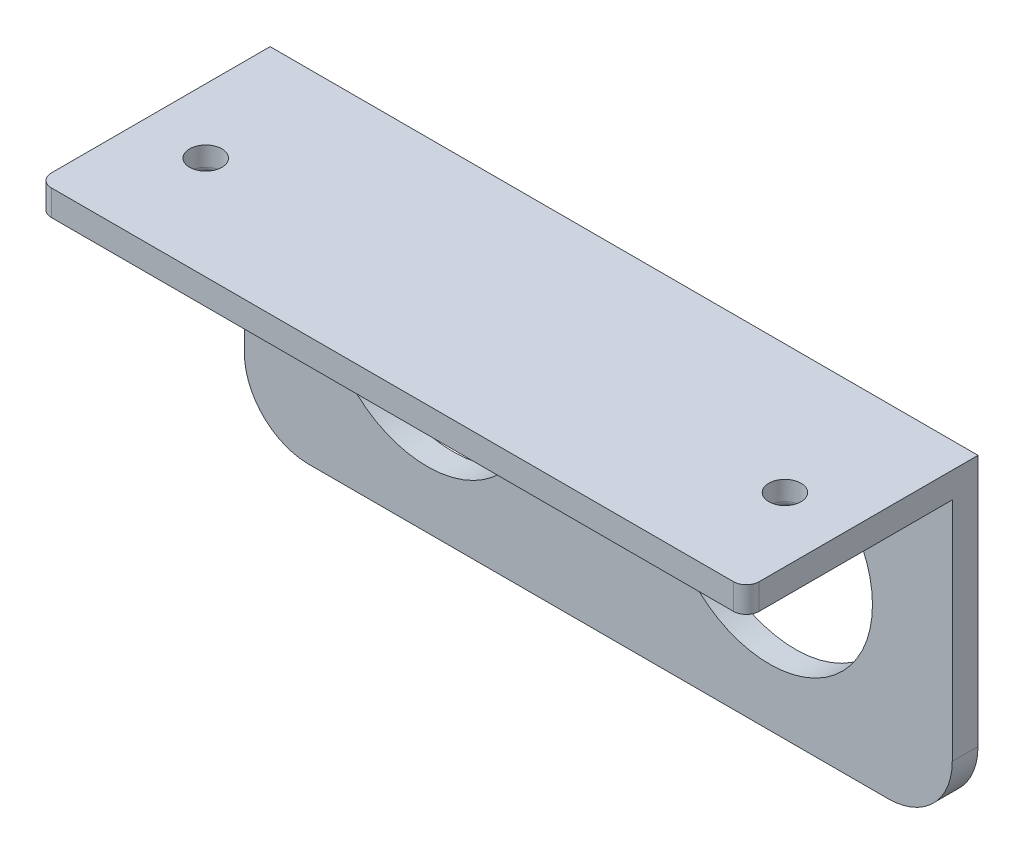
from build123d import *

# Parameters (mm, degrees)
SKETCH1_W             = 55
SKETCH1_H             = 22.6
BOSS_EXTRUDE1_DEPTH   = 2
SKETCH2_R             = 8
CUT_EXTRUDE2_DEPTH    = 2
SKETCH2_4_R           = 8
CUT_EXTRUDE3_DEPTH    = 2
SKETCH5_W             = 10
SKETCH5_H             = 4.7
CUT_EXTRUDE4_DEPTH    = 2
SKETCH6_W             = 55
SKETCH6_H             = 2
BOSS_EXTRUDE2_DEPTH   = 18
M3X0_5_TAPPED_HOLE1_D = 2.5
M3X0_5_TAPPED_HOLE2_D = 2.5
FILLET1_R             = 5
FILLET2_R             = 5
FILLET4_R             = 1.8
FILLET5_R             = 1.8
FILLET10_R            = 1
FILLET12_R            = 0.5
FILLET13_R            = 0.5


with BuildPart() as part:
    # Sketch1 → Boss-Extrude1 (new body)
    with BuildSketch(Plane.XY):
        with Locations((-1.071942446, 12.368165468)):
            Rectangle(SKETCH1_W, SKETCH1_H)
    extrude(amount=BOSS_EXTRUDE1_DEPTH)

    # Sketch2 → Cut-Extrude2 (cut)
    with BuildSketch(Plane.XY.offset(2)):
        with Locations((-14.371942446, 13.518165468)):
            Circle(SKETCH2_R)
    extrude(amount=-CUT_EXTRUDE2_DEPTH, mode=Mode.SUBTRACT)

    # Sketch2<4> → Cut-Extrude3 (cut)
    with BuildSketch(Plane.XY.offset(2)):
        with Locations((-14.371942446, 13.518165468)):
            Circle(SKETCH2_4_R)
        with Locations((12.228057554, 13.518165468)):
            Circle(SKETCH2_4_R)
    extrude(amount=-CUT_EXTRUDE3_DEPTH, mode=Mode.SUBTRACT)

    # Sketch5 → Cut-Extrude4 (cut)
    with BuildSketch(Plane.XY.offset(2)):
        with Locations((-1.171942446, 21.318165468)):
            Rectangle(SKETCH5_W, SKETCH5_H)
    extrude(amount=-CUT_EXTRUDE4_DEPTH, mode=Mode.SUBTRACT)

    # Sketch6 → Boss-Extrude2 (add)
    with BuildSketch(Plane(origin=(0, 0, 0), x_dir=(-1, 0, 0), z_dir=(0, 0, -1))):
        with Locations((1.071942446, 24.668165468)):
            Rectangle(SKETCH6_W, SKETCH6_H)
    extrude(amount=-BOSS_EXTRUDE2_DEPTH)

    # M3x0.5 Tapped Hole1 (through all)
    with Locations(Plane(origin=(0, 23.668165468, 0), x_dir=(-1, 0, 0), z_dir=(0, -1, 0))):
        with Locations((-21.428057554, -10)):
            Hole(M3X0_5_TAPPED_HOLE1_D / 2)

    # M3x0.5 Tapped Hole2 (through all)
    with Locations(Plane(origin=(0, 23.668165468, 0), x_dir=(-1, 0, 0), z_dir=(0, -1, 0))):
        with Locations((23.571942446, -10)):
            Hole(M3X0_5_TAPPED_HOLE2_D / 2)

    # Fillet1
    fillet1_edges = [part.edges().sort_by_distance(p)[0] for p in [
        (-28.571942446, 1.068165468, 1),
    ]]
    fillet(fillet1_edges, radius=FILLET1_R)

    # Fillet2
    fillet2_edges = [part.edges().sort_by_distance(p)[0] for p in [
        (26.428057554, 1.068165468, 1),
    ]]
    fillet(fillet2_edges, radius=FILLET2_R)

    # Fillet4
    fillet4_edges = [part.edges().sort_by_distance(p)[0] for p in [
        (3.828057554, 18.968165468, 1),
    ]]
    fillet(fillet4_edges, radius=FILLET4_R)

    # Fillet5
    fillet5_edges = [part.edges().sort_by_distance(p)[0] for p in [
        (-6.171942446, 18.968165468, 1),
    ]]
    fillet(fillet5_edges, radius=FILLET5_R)

    # Fillet10
    fillet10_edges = [part.edges().sort_by_distance(p)[0] for p in [
        (26.428057554, 24.668165468, 18),
        (-28.571942446, 24.668165468, 18),
    ]]
    fillet(fillet10_edges, radius=FILLET10_R)

    # Fillet12
    fillet12_edges = [part.edges().sort_by_distance(p)[0] for p in [
        (-24.821942446, 23.668165468, 10),
    ]]
    fillet(fillet12_edges, radius=FILLET12_R)

    # Fillet13
    fillet13_edges = [part.edges().sort_by_distance(p)[0] for p in [
        (20.178057554, 23.668165468, 10),
    ]]
    fillet(fillet13_edges, radius=FILLET13_R)


solid = part.part
